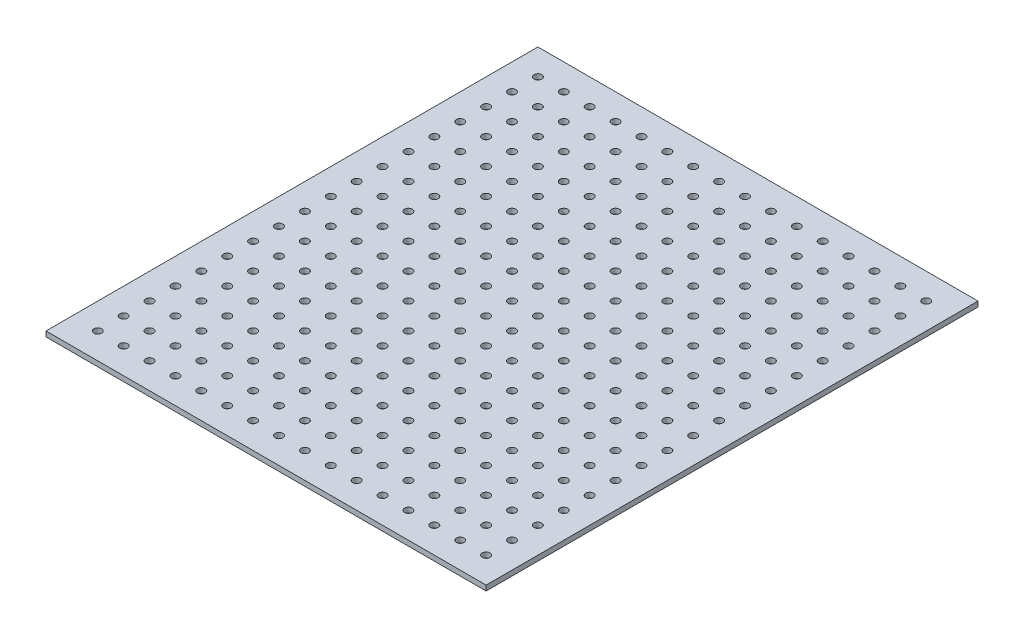
from build123d import *

# Parameters (mm, degrees)
SKETCH1_W           = 170
SKETCH1_H           = 190
BOSS_EXTRUDE1_DEPTH = 2
SKETCH2_R           = 1.5
CUT_EXTRUDE1_DEPTH  = 128.491176165


with BuildPart() as part:
    # Sketch1 → Boss-Extrude1 (new body)
    with BuildSketch(Plane(origin=(0, 0, 0), x_dir=(1, 0, 0), z_dir=(0, 1, 0))):
        Rectangle(SKETCH1_W, SKETCH1_H)
    extrude(amount=BOSS_EXTRUDE1_DEPTH)

    # Sketch2 → Cut-Extrude1 (cut, through all)
    with BuildSketch(Plane(origin=(0, 2, 0), x_dir=(1, 0, 0), z_dir=(0, 1, 0))):
        with Locations((-75, 85)):
            Circle(SKETCH2_R)
        with Locations((-65, 85)):
            Circle(SKETCH2_R)
        with Locations((-55, 85)):
            Circle(SKETCH2_R)
        with Locations((-45, 85)):
            Circle(SKETCH2_R)
        with Locations((-35, 85)):
            Circle(SKETCH2_R)
        with Locations((-25, 85)):
            Circle(SKETCH2_R)
        with Locations((-15, 85)):
            Circle(SKETCH2_R)
        with Locations((-5, 85)):
            Circle(SKETCH2_R)
        with Locations((5, 85)):
            Circle(SKETCH2_R)
        with Locations((15, 85)):
            Circle(SKETCH2_R)
        with Locations((25, 85)):
            Circle(SKETCH2_R)
        with Locations((35, 85)):
            Circle(SKETCH2_R)
        with Locations((45, 85)):
            Circle(SKETCH2_R)
        with Locations((55, 85)):
            Circle(SKETCH2_R)
        with Locations((65, 85)):
            Circle(SKETCH2_R)
        with Locations((75, 85)):
            Circle(SKETCH2_R)
        with Locations((-65, 75)):
            Circle(SKETCH2_R)
        with Locations((-55, 75)):
            Circle(SKETCH2_R)
        with Locations((-45, 75)):
            Circle(SKETCH2_R)
        with Locations((-35, 75)):
            Circle(SKETCH2_R)
        with Locations((-25, 75)):
            Circle(SKETCH2_R)
        with Locations((-15, 75)):
            Circle(SKETCH2_R)
        with Locations((-5, 75)):
            Circle(SKETCH2_R)
        with Locations((5, 75)):
            Circle(SKETCH2_R)
        with Locations((15, 75)):
            Circle(SKETCH2_R)
        with Locations((25, 75)):
            Circle(SKETCH2_R)
        with Locations((35, 75)):
            Circle(SKETCH2_R)
        with Locations((45, 75)):
            Circle(SKETCH2_R)
        with Locations((55, 75)):
            Circle(SKETCH2_R)
        with Locations((65, 75)):
            Circle(SKETCH2_R)
        with Locations((75, 75)):
            Circle(SKETCH2_R)
        with Locations((-65, 65)):
            Circle(SKETCH2_R)
        with Locations((-55, 65)):
            Circle(SKETCH2_R)
        with Locations((-45, 65)):
            Circle(SKETCH2_R)
        with Locations((-35, 65)):
            Circle(SKETCH2_R)
        with Locations((-25, 65)):
            Circle(SKETCH2_R)
        with Locations((-15, 65)):
            Circle(SKETCH2_R)
        with Locations((-5, 65)):
            Circle(SKETCH2_R)
        with Locations((5, 65)):
            Circle(SKETCH2_R)
        with Locations((15, 65)):
            Circle(SKETCH2_R)
        with Locations((25, 65)):
            Circle(SKETCH2_R)
        with Locations((35, 65)):
            Circle(SKETCH2_R)
        with Locations((45, 65)):
            Circle(SKETCH2_R)
        with Locations((55, 65)):
            Circle(SKETCH2_R)
        with Locations((65, 65)):
            Circle(SKETCH2_R)
        with Locations((75, 65)):
            Circle(SKETCH2_R)
        with Locations((-65, 55)):
            Circle(SKETCH2_R)
        with Locations((-55, 55)):
            Circle(SKETCH2_R)
        with Locations((-45, 55)):
            Circle(SKETCH2_R)
        with Locations((-35, 55)):
            Circle(SKETCH2_R)
        with Locations((-25, 55)):
            Circle(SKETCH2_R)
        with Locations((-15, 55)):
            Circle(SKETCH2_R)
        with Locations((-5, 55)):
            Circle(SKETCH2_R)
        with Locations((5, 55)):
            Circle(SKETCH2_R)
        with Locations((15, 55)):
            Circle(SKETCH2_R)
        with Locations((25, 55)):
            Circle(SKETCH2_R)
        with Locations((35, 55)):
            Circle(SKETCH2_R)
        with Locations((45, 55)):
            Circle(SKETCH2_R)
        with Locations((55, 55)):
            Circle(SKETCH2_R)
        with Locations((65, 55)):
            Circle(SKETCH2_R)
        with Locations((75, 55)):
            Circle(SKETCH2_R)
        with Locations((-65, 45)):
            Circle(SKETCH2_R)
        with Locations((-55, 45)):
            Circle(SKETCH2_R)
        with Locations((-45, 45)):
            Circle(SKETCH2_R)
        with Locations((-35, 45)):
            Circle(SKETCH2_R)
        with Locations((-25, 45)):
            Circle(SKETCH2_R)
        with Locations((-15, 45)):
            Circle(SKETCH2_R)
        with Locations((-5, 45)):
            Circle(SKETCH2_R)
        with Locations((5, 45)):
            Circle(SKETCH2_R)
        with Locations((15, 45)):
            Circle(SKETCH2_R)
        with Locations((25, 45)):
            Circle(SKETCH2_R)
        with Locations((35, 45)):
            Circle(SKETCH2_R)
        with Locations((45, 45)):
            Circle(SKETCH2_R)
        with Locations((55, 45)):
            Circle(SKETCH2_R)
        with Locations((65, 45)):
            Circle(SKETCH2_R)
        with Locations((75, 45)):
            Circle(SKETCH2_R)
        with Locations((-65, 35)):
            Circle(SKETCH2_R)
        with Locations((-55, 35)):
            Circle(SKETCH2_R)
        with Locations((-45, 35)):
            Circle(SKETCH2_R)
        with Locations((-35, 35)):
            Circle(SKETCH2_R)
        with Locations((-25, 35)):
            Circle(SKETCH2_R)
        with Locations((-15, 35)):
            Circle(SKETCH2_R)
        with Locations((-5, 35)):
            Circle(SKETCH2_R)
        with Locations((5, 35)):
            Circle(SKETCH2_R)
        with Locations((15, 35)):
            Circle(SKETCH2_R)
        with Locations((25, 35)):
            Circle(SKETCH2_R)
        with Locations((35, 35)):
            Circle(SKETCH2_R)
        with Locations((45, 35)):
            Circle(SKETCH2_R)
        with Locations((55, 35)):
            Circle(SKETCH2_R)
        with Locations((65, 35)):
            Circle(SKETCH2_R)
        with Locations((75, 35)):
            Circle(SKETCH2_R)
        with Locations((-65, 25)):
            Circle(SKETCH2_R)
        with Locations((-55, 25)):
            Circle(SKETCH2_R)
        with Locations((-45, 25)):
            Circle(SKETCH2_R)
        with Locations((-35, 25)):
            Circle(SKETCH2_R)
        with Locations((-25, 25)):
            Circle(SKETCH2_R)
        with Locations((-15, 25)):
            Circle(SKETCH2_R)
        with Locations((-5, 25)):
            Circle(SKETCH2_R)
        with Locations((5, 25)):
            Circle(SKETCH2_R)
        with Locations((15, 25)):
            Circle(SKETCH2_R)
        with Locations((25, 25)):
            Circle(SKETCH2_R)
        with Locations((35, 25)):
            Circle(SKETCH2_R)
        with Locations((45, 25)):
            Circle(SKETCH2_R)
        with Locations((55, 25)):
            Circle(SKETCH2_R)
        with Locations((65, 25)):
            Circle(SKETCH2_R)
        with Locations((75, 25)):
            Circle(SKETCH2_R)
        with Locations((-65, 15)):
            Circle(SKETCH2_R)
        with Locations((-55, 15)):
            Circle(SKETCH2_R)
        with Locations((-45, 15)):
            Circle(SKETCH2_R)
        with Locations((-35, 15)):
            Circle(SKETCH2_R)
        with Locations((-25, 15)):
            Circle(SKETCH2_R)
        with Locations((-15, 15)):
            Circle(SKETCH2_R)
        with Locations((-5, 15)):
            Circle(SKETCH2_R)
        with Locations((5, 15)):
            Circle(SKETCH2_R)
        with Locations((15, 15)):
            Circle(SKETCH2_R)
        with Locations((25, 15)):
            Circle(SKETCH2_R)
        with Locations((35, 15)):
            Circle(SKETCH2_R)
        with Locations((45, 15)):
            Circle(SKETCH2_R)
        with Locations((55, 15)):
            Circle(SKETCH2_R)
        with Locations((65, 15)):
            Circle(SKETCH2_R)
        with Locations((75, 15)):
            Circle(SKETCH2_R)
        with Locations((-65, 5)):
            Circle(SKETCH2_R)
        with Locations((-55, 5)):
            Circle(SKETCH2_R)
        with Locations((-45, 5)):
            Circle(SKETCH2_R)
        with Locations((-35, 5)):
            Circle(SKETCH2_R)
        with Locations((-25, 5)):
            Circle(SKETCH2_R)
        with Locations((-15, 5)):
            Circle(SKETCH2_R)
        with Locations((-5, 5)):
            Circle(SKETCH2_R)
        with Locations((5, 5)):
            Circle(SKETCH2_R)
        with Locations((15, 5)):
            Circle(SKETCH2_R)
        with Locations((25, 5)):
            Circle(SKETCH2_R)
        with Locations((35, 5)):
            Circle(SKETCH2_R)
        with Locations((45, 5)):
            Circle(SKETCH2_R)
        with Locations((55, 5)):
            Circle(SKETCH2_R)
        with Locations((65, 5)):
            Circle(SKETCH2_R)
        with Locations((75, 5)):
            Circle(SKETCH2_R)
        with Locations((-65, -5)):
            Circle(SKETCH2_R)
        with Locations((-55, -5)):
            Circle(SKETCH2_R)
        with Locations((-45, -5)):
            Circle(SKETCH2_R)
        with Locations((-35, -5)):
            Circle(SKETCH2_R)
        with Locations((-25, -5)):
            Circle(SKETCH2_R)
        with Locations((-15, -5)):
            Circle(SKETCH2_R)
        with Locations((-5, -5)):
            Circle(SKETCH2_R)
        with Locations((5, -5)):
            Circle(SKETCH2_R)
        with Locations((15, -5)):
            Circle(SKETCH2_R)
        with Locations((25, -5)):
            Circle(SKETCH2_R)
        with Locations((35, -5)):
            Circle(SKETCH2_R)
        with Locations((45, -5)):
            Circle(SKETCH2_R)
        with Locations((55, -5)):
            Circle(SKETCH2_R)
        with Locations((65, -5)):
            Circle(SKETCH2_R)
        with Locations((75, -5)):
            Circle(SKETCH2_R)
        with Locations((-65, -15)):
            Circle(SKETCH2_R)
        with Locations((-55, -15)):
            Circle(SKETCH2_R)
        with Locations((-45, -15)):
            Circle(SKETCH2_R)
        with Locations((-35, -15)):
            Circle(SKETCH2_R)
        with Locations((-25, -15)):
            Circle(SKETCH2_R)
        with Locations((-15, -15)):
            Circle(SKETCH2_R)
        with Locations((-5, -15)):
            Circle(SKETCH2_R)
        with Locations((5, -15)):
            Circle(SKETCH2_R)
        with Locations((15, -15)):
            Circle(SKETCH2_R)
        with Locations((25, -15)):
            Circle(SKETCH2_R)
        with Locations((35, -15)):
            Circle(SKETCH2_R)
        with Locations((45, -15)):
            Circle(SKETCH2_R)
        with Locations((55, -15)):
            Circle(SKETCH2_R)
        with Locations((65, -15)):
            Circle(SKETCH2_R)
        with Locations((75, -15)):
            Circle(SKETCH2_R)
        with Locations((-65, -25)):
            Circle(SKETCH2_R)
        with Locations((-55, -25)):
            Circle(SKETCH2_R)
        with Locations((-45, -25)):
            Circle(SKETCH2_R)
        with Locations((-35, -25)):
            Circle(SKETCH2_R)
        with Locations((-25, -25)):
            Circle(SKETCH2_R)
        with Locations((-15, -25)):
            Circle(SKETCH2_R)
        with Locations((-5, -25)):
            Circle(SKETCH2_R)
        with Locations((5, -25)):
            Circle(SKETCH2_R)
        with Locations((15, -25)):
            Circle(SKETCH2_R)
        with Locations((25, -25)):
            Circle(SKETCH2_R)
        with Locations((35, -25)):
            Circle(SKETCH2_R)
        with Locations((45, -25)):
            Circle(SKETCH2_R)
        with Locations((55, -25)):
            Circle(SKETCH2_R)
        with Locations((65, -25)):
            Circle(SKETCH2_R)
        with Locations((75, -25)):
            Circle(SKETCH2_R)
        with Locations((-65, -35)):
            Circle(SKETCH2_R)
        with Locations((-55, -35)):
            Circle(SKETCH2_R)
        with Locations((-45, -35)):
            Circle(SKETCH2_R)
        with Locations((-35, -35)):
            Circle(SKETCH2_R)
        with Locations((-25, -35)):
            Circle(SKETCH2_R)
        with Locations((-15, -35)):
            Circle(SKETCH2_R)
        with Locations((-5, -35)):
            Circle(SKETCH2_R)
        with Locations((5, -35)):
            Circle(SKETCH2_R)
        with Locations((15, -35)):
            Circle(SKETCH2_R)
        with Locations((25, -35)):
            Circle(SKETCH2_R)
        with Locations((35, -35)):
            Circle(SKETCH2_R)
        with Locations((45, -35)):
            Circle(SKETCH2_R)
        with Locations((55, -35)):
            Circle(SKETCH2_R)
        with Locations((65, -35)):
            Circle(SKETCH2_R)
        with Locations((75, -35)):
            Circle(SKETCH2_R)
        with Locations((-65, -45)):
            Circle(SKETCH2_R)
        with Locations((-55, -45)):
            Circle(SKETCH2_R)
        with Locations((-45, -45)):
            Circle(SKETCH2_R)
        with Locations((-35, -45)):
            Circle(SKETCH2_R)
        with Locations((-25, -45)):
            Circle(SKETCH2_R)
        with Locations((-15, -45)):
            Circle(SKETCH2_R)
        with Locations((-5, -45)):
            Circle(SKETCH2_R)
        with Locations((5, -45)):
            Circle(SKETCH2_R)
        with Locations((15, -45)):
            Circle(SKETCH2_R)
        with Locations((25, -45)):
            Circle(SKETCH2_R)
        with Locations((35, -45)):
            Circle(SKETCH2_R)
        with Locations((45, -45)):
            Circle(SKETCH2_R)
        with Locations((55, -45)):
            Circle(SKETCH2_R)
        with Locations((65, -45)):
            Circle(SKETCH2_R)
        with Locations((75, -45)):
            Circle(SKETCH2_R)
        with Locations((-65, -55)):
            Circle(SKETCH2_R)
        with Locations((-55, -55)):
            Circle(SKETCH2_R)
        with Locations((-45, -55)):
            Circle(SKETCH2_R)
        with Locations((-35, -55)):
            Circle(SKETCH2_R)
        with Locations((-25, -55)):
            Circle(SKETCH2_R)
        with Locations((-15, -55)):
            Circle(SKETCH2_R)
        with Locations((-5, -55)):
            Circle(SKETCH2_R)
        with Locations((5, -55)):
            Circle(SKETCH2_R)
        with Locations((15, -55)):
            Circle(SKETCH2_R)
        with Locations((25, -55)):
            Circle(SKETCH2_R)
        with Locations((35, -55)):
            Circle(SKETCH2_R)
        with Locations((45, -55)):
            Circle(SKETCH2_R)
        with Locations((55, -55)):
            Circle(SKETCH2_R)
        with Locations((65, -55)):
            Circle(SKETCH2_R)
        with Locations((75, -55)):
            Circle(SKETCH2_R)
        with Locations((-65, -65)):
            Circle(SKETCH2_R)
        with Locations((-55, -65)):
            Circle(SKETCH2_R)
        with Locations((-45, -65)):
            Circle(SKETCH2_R)
        with Locations((-35, -65)):
            Circle(SKETCH2_R)
        with Locations((-25, -65)):
            Circle(SKETCH2_R)
        with Locations((-15, -65)):
            Circle(SKETCH2_R)
        with Locations((-5, -65)):
            Circle(SKETCH2_R)
        with Locations((5, -65)):
            Circle(SKETCH2_R)
        with Locations((15, -65)):
            Circle(SKETCH2_R)
        with Locations((25, -65)):
            Circle(SKETCH2_R)
        with Locations((35, -65)):
            Circle(SKETCH2_R)
        with Locations((45, -65)):
            Circle(SKETCH2_R)
        with Locations((55, -65)):
            Circle(SKETCH2_R)
        with Locations((65, -65)):
            Circle(SKETCH2_R)
        with Locations((75, -65)):
            Circle(SKETCH2_R)
        with Locations((-65, -75)):
            Circle(SKETCH2_R)
        with Locations((-55, -75)):
            Circle(SKETCH2_R)
        with Locations((-45, -75)):
            Circle(SKETCH2_R)
        with Locations((-35, -75)):
            Circle(SKETCH2_R)
        with Locations((-25, -75)):
            Circle(SKETCH2_R)
        with Locations((-15, -75)):
            Circle(SKETCH2_R)
        with Locations((-5, -75)):
            Circle(SKETCH2_R)
        with Locations((5, -75)):
            Circle(SKETCH2_R)
        with Locations((15, -75)):
            Circle(SKETCH2_R)
        with Locations((25, -75)):
            Circle(SKETCH2_R)
        with Locations((35, -75)):
            Circle(SKETCH2_R)
        with Locations((45, -75)):
            Circle(SKETCH2_R)
        with Locations((55, -75)):
            Circle(SKETCH2_R)
        with Locations((65, -75)):
            Circle(SKETCH2_R)
        with Locations((75, -75)):
            Circle(SKETCH2_R)
        with Locations((-65, -85)):
            Circle(SKETCH2_R)
        with Locations((-55, -85)):
            Circle(SKETCH2_R)
        with Locations((-45, -85)):
            Circle(SKETCH2_R)
        with Locations((-35, -85)):
            Circle(SKETCH2_R)
        with Locations((-25, -85)):
            Circle(SKETCH2_R)
        with Locations((-15, -85)):
            Circle(SKETCH2_R)
        with Locations((-5, -85)):
            Circle(SKETCH2_R)
        with Locations((5, -85)):
            Circle(SKETCH2_R)
        with Locations((15, -85)):
            Circle(SKETCH2_R)
        with Locations((25, -85)):
            Circle(SKETCH2_R)
        with Locations((35, -85)):
            Circle(SKETCH2_R)
        with Locations((45, -85)):
            Circle(SKETCH2_R)
        with Locations((55, -85)):
            Circle(SKETCH2_R)
        with Locations((65, -85)):
            Circle(SKETCH2_R)
        with Locations((75, -85)):
            Circle(SKETCH2_R)
        with Locations((-75, 75)):
            Circle(SKETCH2_R)
        with Locations((-75, 65)):
            Circle(SKETCH2_R)
        with Locations((-75, 55)):
            Circle(SKETCH2_R)
        with Locations((-75, 45)):
            Circle(SKETCH2_R)
        with Locations((-75, 35)):
            Circle(SKETCH2_R)
        with Locations((-75, 25)):
            Circle(SKETCH2_R)
        with Locations((-75, 15)):
            Circle(SKETCH2_R)
        with Locations((-75, 5)):
            Circle(SKETCH2_R)
        with Locations((-75, -5)):
            Circle(SKETCH2_R)
        with Locations((-75, -15)):
            Circle(SKETCH2_R)
        with Locations((-75, -25)):
            Circle(SKETCH2_R)
        with Locations((-75, -35)):
            Circle(SKETCH2_R)
        with Locations((-75, -45)):
            Circle(SKETCH2_R)
        with Locations((-75, -55)):
            Circle(SKETCH2_R)
        with Locations((-75, -65)):
            Circle(SKETCH2_R)
        with Locations((-75, -75)):
            Circle(SKETCH2_R)
        with Locations((-75, -85)):
            Circle(SKETCH2_R)
    extrude(amount=-CUT_EXTRUDE1_DEPTH, mode=Mode.SUBTRACT)


solid = part.part
